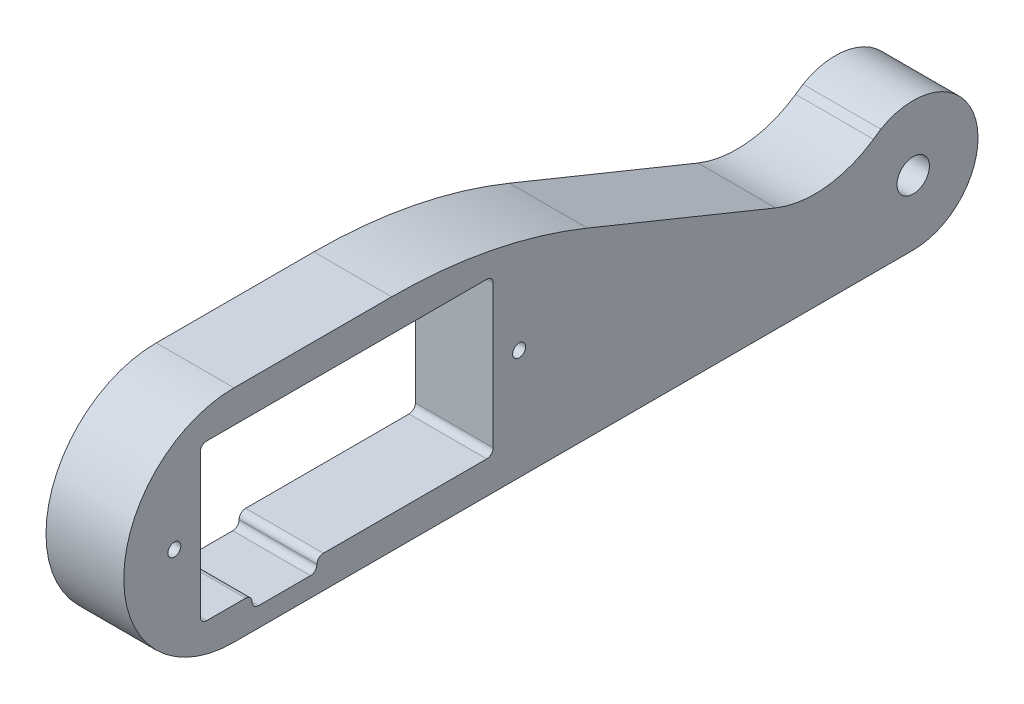
from build123d import *

# Parameters (mm, degrees)
SCHIZZO1_R                   = 0.5
SCHIZZO1_R_2                 = 1.25
ESTRUSIONE_ESTRUSIONE1_DEPTH = 6
RACCORDO1_R                  = 8
RACCORDO2_R                  = 40
RACCORDO3_R                  = 0.5


with BuildPart() as part:
    # Schizzo1 → Estrusione-Estrusione1 (new body)
    with BuildSketch(Plane(origin=(0, 0, 0), x_dir=(0, 0, -1), z_dir=(1, 0, 0))):
        with BuildLine():
            Line((22.6, 14.5), (2.6, 14.5))
            ThreePointArc((2.6, 14.5), (-5.9, 6), (2.6, -2.5))
            Line((2.6, -2.5), (55, -2.5))
            ThreePointArc((55, -2.5), (59.829629131, 3.794095226), (52.5, 6.830127019))
            Line((52.5, 6.830127019), (48.378061008, 4))
            Line((48.378061008, 4), (22.6, 14.5))
        make_face()
        Polygon((0, 0), (0, 12), (22.6, 12), (22.6, 0), (9, 0), (9, -1), (4, -1), (4, 0), align=None, mode=Mode.SUBTRACT)
        with Locations((-2, 6)):
            Circle(SCHIZZO1_R, mode=Mode.SUBTRACT)
        with Locations((24.6, 6)):
            Circle(SCHIZZO1_R, mode=Mode.SUBTRACT)
        with Locations((55, 2.5)):
            Circle(SCHIZZO1_R_2, mode=Mode.SUBTRACT)
    extrude(amount=ESTRUSIONE_ESTRUSIONE1_DEPTH)

    # Raccordo1
    raccordo1_edges = [part.edges().sort_by_distance(p)[0] for p in [
        (3, 4, -48.378061008),
    ]]
    fillet(raccordo1_edges, radius=RACCORDO1_R)

    # Raccordo2
    raccordo2_edges = [part.edges().sort_by_distance(p)[0] for p in [
        (3, 14.5, -22.6),
    ]]
    fillet(raccordo2_edges, radius=RACCORDO2_R)

    # Raccordo3
    raccordo3_edges = [part.edges().sort_by_distance(p)[0] for p in [
        (3, 0, -22.6),
        (3, 0, 0),
        (3, 12, 0),
        (3, 12, -22.6),
        (3, 0, -4),
        (3, -1, -4),
        (3, -1, -9),
        (3, 0, -9),
    ]]
    fillet(raccordo3_edges, radius=RACCORDO3_R - 0.0001)  # a hair under: the kernel refuses the full size


solid = part.part
